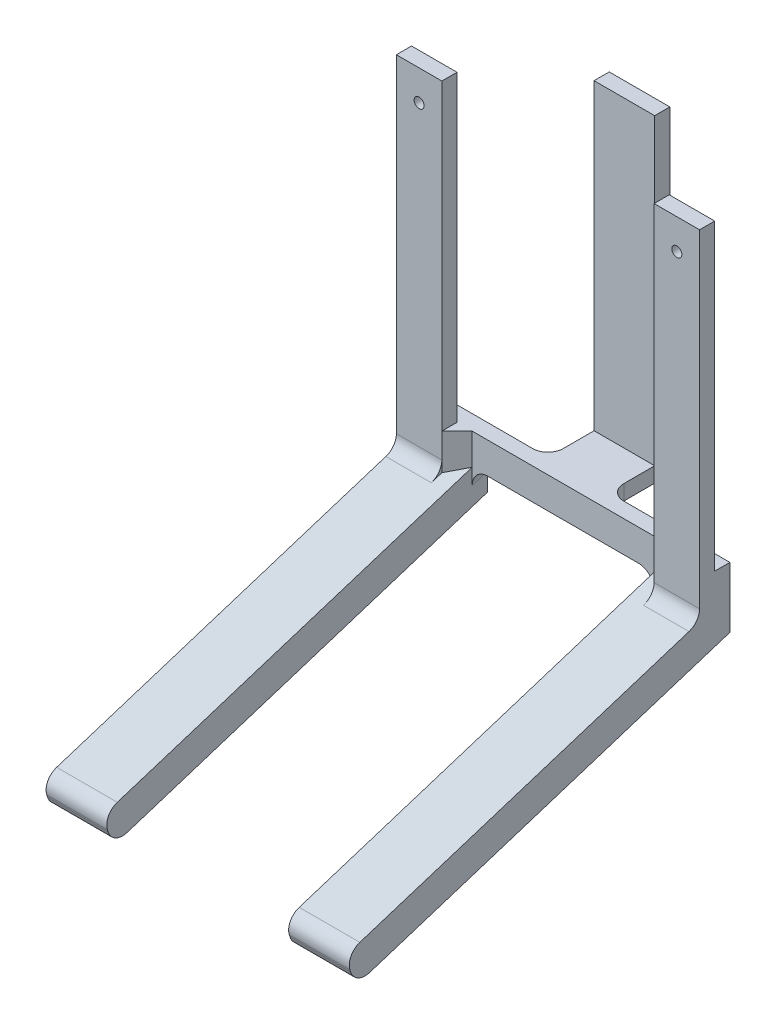
from build123d import *

# Parameters (mm, degrees)
EXTRUDE_1_DEPTH     = 5
EXTRUDE_2_DEPTH     = 5
EXTRUDE_3_DEPTH     = 5
EXTRUDE_4_DEPTH     = 5
EXTRUDE_5_DEPTH     = 50
CUT_EXTRUDE_1_DEPTH = 30
FILLET_1_R          = 5
SKETCH_6_R          = 1.6499999999999952
CUT_EXTRUDE_2_DEPTH = 60
FILLET_2_R          = 5
CHAMFER_1_SIZE      = 5
FILLET_3_R          = 5
FILLET_4_R          = 5


# Some blends are built 0.0001 mm under size
with BuildPart() as part:
    # 스케치1 → 보스-돌출1 (new body)
    with BuildSketch(Plane.XY):
        Polygon((-10.000000000000016, 100), (10.000000000000016, 100), (10.000000000000002, 0), (-10.000000000000002, 0), align=None)
    extrude(amount=EXTRUDE_1_DEPTH)

    # 스케치2 → 보스-돌출2 (add)
    with BuildSketch(Plane(origin=(0, 0, 0), x_dir=(1, 0, 0), z_dir=(0, 1, 0))):
        Polygon((-10.000000000000002, 0), (10.000000000000002, 0), (10.000000000000005, -25.2), (-9.999999999999998, -25.2), align=None)
    extrude(amount=-EXTRUDE_2_DEPTH)

    # 스케치3 → 보스-돌출3 (add)
    with BuildSketch(Plane.XY.offset(25.2)):
        Polygon((-50, 0), (50, 0), (50, -19.999999999999986), (-50, -20), align=None)
    extrude(amount=-EXTRUDE_3_DEPTH)

    # 스케치4 → 보스-돌출4 (add)
    with BuildSketch(Plane.XY.offset(25.2)):
        Polygon((50, -19.999999999999996), (35, -19.999999999999996), (34.99999999999999, 100.00000000000001), (49.999999999999986, 100.00000000000001), align=None)
        Polygon((-50.000000000000014, 100), (-35.000000000000014, 100), (-35, -19.999999999999996), (-50, -19.999999999999996), align=None)
    extrude(amount=EXTRUDE_4_DEPTH)

    # 스케치5 → 보스-돌출5 (add, symmetric)
    with BuildSketch(Plane(origin=(0, 0, 0), x_dir=(0, 0, -1), z_dir=(1, 0, 0))):
        Polygon((-20.2, -20), (-143.76355340335743, -59.26033642854078), (-147.01597593744285, -49.02402869306782), (-20.2, -8.730287191761477), align=None)
    extrude(amount=EXTRUDE_5_DEPTH, both=True)

    # 스케치5<3> → 컷-돌출1 (cut, symmetric)
    with BuildSketch(Plane(origin=(0, 0, 0), x_dir=(0, 0, -1), z_dir=(1, 0, 0))):
        Polygon((-20.2, -20), (-143.76355340335743, -59.26033642854078), (-147.01597593744285, -49.02402869306782), (-20.2, -8.730287191761477), align=None)
    extrude(amount=CUT_EXTRUDE_1_DEPTH, both=True, mode=Mode.SUBTRACT)

    # 필렛1
    fillet_1_edges = [part.edges().sort_by_distance(p)[0] for p in [
        (42.5, -11.90762673462655, 30.199999999999996),
        (-42.5, -11.90762673462655, 30.199999999999996),
    ]]
    fillet(fillet_1_edges, radius=FILLET_1_R)

    # 스케치6 → 컷-돌출2 (cut)
    with BuildSketch(Plane.XY.offset(30.200000000000003)):
        with Locations((-42.500000000000014, 90.00000000000001)):
            Circle(SKETCH_6_R)
        with Locations(Location((42.500000000000014, 90.00000000000001, 0), (0, 0, 180))):
            Circle(SKETCH_6_R)
    extrude(amount=-CUT_EXTRUDE_2_DEPTH, mode=Mode.SUBTRACT)

    # 필렛2
    fillet_2_edges = [part.edges().sort_by_distance(p)[0] for p in [
        (-40, -59.26033642854078, 143.76355340335743),
        (-40, -49.02402869306782, 147.01597593744285),
        (40, -49.02402869306782, 147.01597593744285),
        (40, -59.26033642854078, 143.76355340335743),
    ]]
    fillet(fillet_2_edges, radius=FILLET_2_R)

    # 모따기1
    chamfer_1_edges = [part.edges().sort_by_distance(p)[0] for p in [
        (-35, -5.159478481597006, 25.2),
        (35, -5.159478481597006, 25.2),
    ]]
    chamfer(chamfer_1_edges, length=CHAMFER_1_SIZE - 0.0001)  # a hair under: the kernel refuses the full size

    # 필렛3
    fillet_3_edges = [part.edges().sort_by_distance(p)[0] for p in [
        (30, -9.52462207747773, 22.699999999999974),
        (-30, -9.52462207747773, 22.699999999999974),
    ]]
    fillet(fillet_3_edges, radius=FILLET_3_R)

    # 필렛4
    # the kernel refuses this fillet: 5 mm, written as the material it adds along each edge
    with BuildSketch(Plane(origin=(10, -5, 20.2), x_dir=(1, -1.4e-16, 0), z_dir=(1.4e-16, 1, 0)), Plane(origin=(-10, 0, 20.2), x_dir=(-1, -1.4e-16, 0), z_dir=(1.4e-16, -1, 0))) as fillet_4_piece_1:
        with BuildLine():
            CenterArc((FILLET_4_R, FILLET_4_R), FILLET_4_R, 180, 90)
            Line((0, FILLET_4_R), (-FILLET_4_R * 0.02, FILLET_4_R))
            Line((-FILLET_4_R * 0.02, FILLET_4_R), (-FILLET_4_R * 0.02, -FILLET_4_R * 0.02))
            Line((-FILLET_4_R * 0.02, -FILLET_4_R * 0.02), (FILLET_4_R, -FILLET_4_R * 0.02))
            Line((FILLET_4_R, -FILLET_4_R * 0.02), (FILLET_4_R, 0))
        make_face()
    extrude(amount=5)
    with BuildSketch(Plane(origin=(-10.000000000000004, -5, 20.2), x_dir=(0, -1, 0), z_dir=(1, 0, 0))) as fillet_4_piece_2:
        with BuildLine():
            CenterArc((5, 4.8360965028207445), FILLET_4_R, 180, 75.28906399659809)
            Line((0, 4.8360965028207445), (-0.09999999999999964, 4.8360965028207445))
            Line((-0.09999999999999964, 4.8360965028207445), (-0.09999999999999964, 0))
            Line((-0.09999999999999964, 0), (0, -0.10000000000000142))
            ThreePointArc((0, -0.10000000000000142), (1.8651435958807383, -0.10000000000000142), (3.704892935596707, -0.0967219300564146))
            Line((3.704892935596707, -0.0967219300564146), (3.7302871917614766, 0))
        make_face()
    extrude(amount=20.000000000000007)
    with BuildSketch(Plane(origin=(-10.000000000000004, -5, 20.2), x_dir=(0, -1, 0), z_dir=(1, 0, 0))) as fillet_4_piece_3a_section:
        with BuildLine():
            CenterArc((5, 4.8360965028207445), FILLET_4_R, 180, 75.28906399659809)
            Line((0, 4.8360965028207445), (-0.09999999999999964, 4.8360965028207445))
            Line((-0.09999999999999964, 4.8360965028207445), (-0.09999999999999964, 0))
            Line((-0.09999999999999964, 0), (0, -0.10000000000000142))
            ThreePointArc((0, -0.10000000000000142), (1.8651435958807383, -0.10000000000000142), (3.704892935596707, -0.0967219300564146))
            Line((3.704892935596707, -0.0967219300564146), (3.7302871917614766, 0))
        make_face()
    fillet_4_piece_3a = extrude(amount=32.09024125705187, mode=Mode.PRIVATE)
    fillet_4_piece_3a = split(fillet_4_piece_3a, bisect_by=Plane(origin=(10.000000000000004, -5.000000000000003, 20.2), z_dir=(1, -1.4e-16, 0)), keep=Keep.TOP, mode=Mode.PRIVATE)
    with BuildSketch(Plane(origin=(9.999999999999998, -17.5, 20.2), x_dir=(1, -1.4e-16, 0), z_dir=(1.4e-16, 1, 0))) as fillet_4_piece_3b_section:
        with BuildLine():
            CenterArc((FILLET_4_R, FILLET_4_R), FILLET_4_R, 180, 90)
            Line((0, FILLET_4_R), (-FILLET_4_R * 0.02, FILLET_4_R))
            Line((-FILLET_4_R * 0.02, FILLET_4_R), (-FILLET_4_R * 0.02, -FILLET_4_R * 0.02))
            Line((-FILLET_4_R * 0.02, -FILLET_4_R * 0.02), (FILLET_4_R, -FILLET_4_R * 0.02))
            Line((FILLET_4_R, -FILLET_4_R * 0.02), (FILLET_4_R, 0))
        make_face()
    fillet_4_piece_3b = extrude(amount=17.5, mode=Mode.PRIVATE)
    fillet_4_piece_3b = split(fillet_4_piece_3b, bisect_by=Plane(origin=(9.999999999999998, -9.534448385301843, 22.730926212611323), z_dir=(0, 0.9530490272330943, 0.3028160360516808)), keep=Keep.TOP, mode=Mode.PRIVATE)
    fillet_4_piece_3b = split(fillet_4_piece_3b, bisect_by=Plane(origin=(9.999999999999998, -5, 20.2), z_dir=(0, -1, 0)), keep=Keep.TOP, mode=Mode.PRIVATE)
    fillet_4_piece_3 = fillet_4_piece_3a & fillet_4_piece_3b
    add(fillet_4_piece_3)
    with BuildSketch(Plane(origin=(-10, 0, 20.2), x_dir=(-1, -1.4e-16, 0), z_dir=(1.4e-16, -1, 0))) as fillet_4_piece_4a_section:
        with BuildLine():
            CenterArc((FILLET_4_R, FILLET_4_R), FILLET_4_R, 180, 90)
            Line((0, FILLET_4_R), (-FILLET_4_R * 0.02, FILLET_4_R))
            Line((-FILLET_4_R * 0.02, FILLET_4_R), (-FILLET_4_R * 0.02, -FILLET_4_R * 0.02))
            Line((-FILLET_4_R * 0.02, -FILLET_4_R * 0.02), (FILLET_4_R, -FILLET_4_R * 0.02))
            Line((FILLET_4_R, -FILLET_4_R * 0.02), (FILLET_4_R, 0))
        make_face()
    fillet_4_piece_4a = extrude(amount=17.5, mode=Mode.PRIVATE)
    fillet_4_piece_4a = split(fillet_4_piece_4a, bisect_by=Plane(origin=(-10, -7.929741230725918, 17.680451962292693), z_dir=(0, 0.9530490272330943, 0.3028160360516808)), keep=Keep.TOP, mode=Mode.PRIVATE)
    fillet_4_piece_4a = split(fillet_4_piece_4a, bisect_by=Plane(origin=(-10, -5, 20.2), z_dir=(0, -1, 0)), keep=Keep.TOP, mode=Mode.PRIVATE)
    with BuildSketch(Plane(origin=(-22.090241257051865, -5, 20.2), x_dir=(0, -1, 0), z_dir=(1, 0, 0))) as fillet_4_piece_4b_section:
        with BuildLine():
            CenterArc((5, 4.8360965028207445), FILLET_4_R, 180, 75.28906399659809)
            Line((0, 4.8360965028207445), (-0.09999999999999964, 4.8360965028207445))
            Line((-0.09999999999999964, 4.8360965028207445), (-0.09999999999999964, 0))
            Line((-0.09999999999999964, 0), (0, -0.10000000000000142))
            ThreePointArc((0, -0.10000000000000142), (1.8651435958807383, -0.10000000000000142), (3.704892935596707, -0.0967219300564146))
            Line((3.704892935596707, -0.0967219300564146), (3.7302871917614766, 0))
        make_face()
    fillet_4_piece_4b = extrude(amount=32.09024125705187, mode=Mode.PRIVATE)
    fillet_4_piece_4b = split(fillet_4_piece_4b, bisect_by=Plane(origin=(-10.000000000000002, -4.999999999999998, 20.2), z_dir=(-1, -1.4e-16, 0)), keep=Keep.TOP, mode=Mode.PRIVATE)
    fillet_4_piece_4 = fillet_4_piece_4a & fillet_4_piece_4b
    add(fillet_4_piece_4)


solid = part.part
